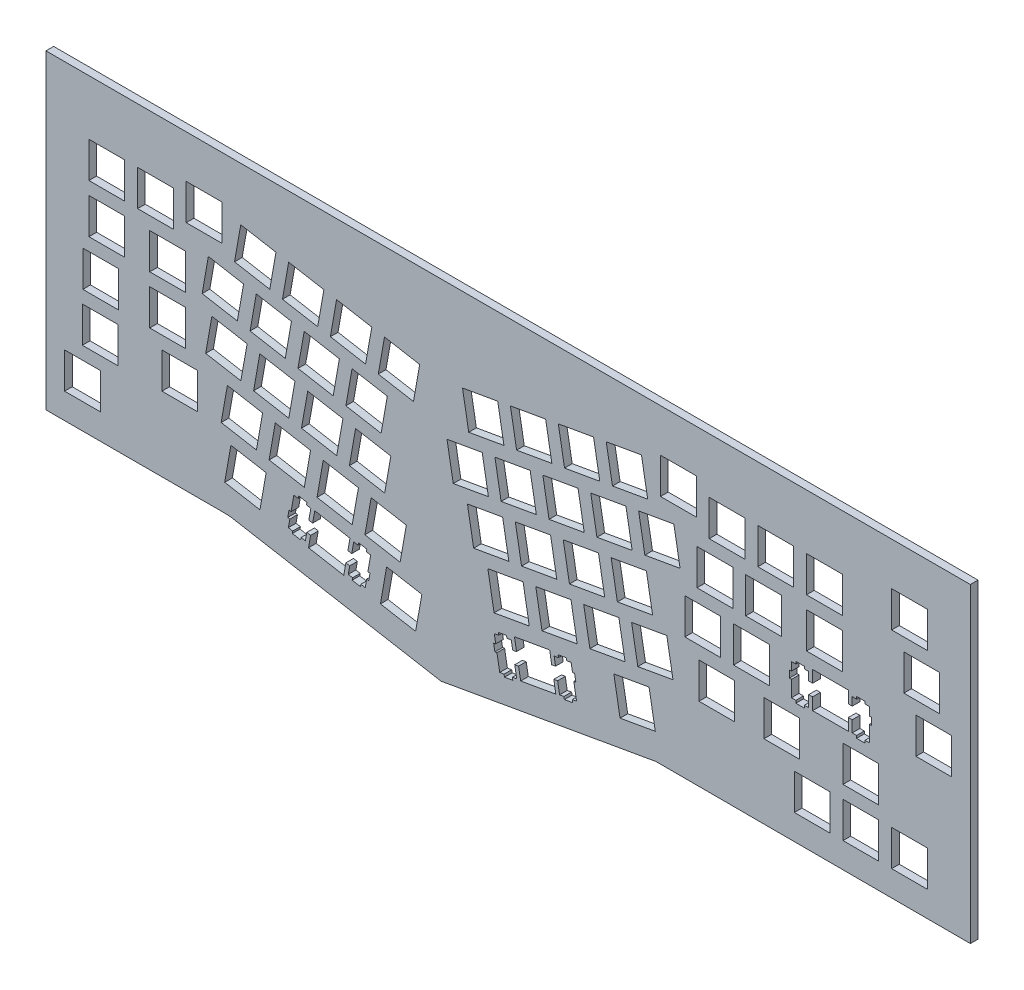
from build123d import *

# Parameters (mm, degrees)
RESSALTO_EXTRUS_O1_OUTLINE_W    = 385.763002014
RESSALTO_EXTRUS_O1_OUTLINE_H    = 172.784175795
RESSALTO_EXTRUS_O1_OUTLINE_W_2  = 13.999553143
RESSALTO_EXTRUS_O1_OUTLINE_H_2  = 14.000893144
RESSALTO_EXTRUS_O1_OUTLINE_W_3  = 13.999543143
RESSALTO_EXTRUS_O1_OUTLINE_H_3  = 14.000703143
RESSALTO_EXTRUS_O1_OUTLINE_W_4  = 13.998003143
RESSALTO_EXTRUS_O1_OUTLINE_W_5  = 14.000003143
RESSALTO_EXTRUS_O1_OUTLINE_W_6  = 14.000003144
RESSALTO_EXTRUS_O1_OUTLINE_W_7  = 13.999503143
RESSALTO_EXTRUS_O1_OUTLINE_H_4  = 13.999303143
RESSALTO_EXTRUS_O1_OUTLINE_H_5  = 13.999103143
RESSALTO_EXTRUS_O1_OUTLINE_W_8  = 13.999303144
RESSALTO_EXTRUS_O1_OUTLINE_W_9  = 13.999303143
RESSALTO_EXTRUS_O1_OUTLINE_W_10 = 13.999403143
RESSALTO_EXTRUS_O1_OUTLINE_H_6  = 13.999003143
RESSALTO_EXTRUS_O1_OUTLINE_H_7  = 14.000003143
RESSALTO_EXTRUS_O1_OUTLINE_W_11 = 14.001003144
RESSALTO_EXTRUS_O1_OUTLINE_W_12 = 13.999003143
RESSALTO_EXTRUS_O1_OUTLINE_H_8  = 14.000003144
RESSALTO_EXTRUS_O1_OUTLINE_W_13 = 13.999003144
RESSALTO_EXTRUS_O1_DEPTH        = 3
CORTE_EXTRUS_O1_DEPTH           = 3


# Read off the part's stored shape, not the designer's step: Ressalto-extrusão1
with BuildPart() as part:
    # Ressalto-extrusão1 outline → Ressalto-extrusão1 (new body)
    with BuildSketch(Plane.XY):
        with Locations((-32.928151592, -125.295959232)):
            Rectangle(RESSALTO_EXTRUS_O1_OUTLINE_W, RESSALTO_EXTRUS_O1_OUTLINE_H)
        with Locations((-216.285310061, -202.161652991)):
            Rectangle(RESSALTO_EXTRUS_O1_OUTLINE_W_2, RESSALTO_EXTRUS_O1_OUTLINE_H_2, mode=Mode.SUBTRACT)
        with Locations((-211.522803992, -143.677644859)):
            Rectangle(RESSALTO_EXTRUS_O1_OUTLINE_W_3, RESSALTO_EXTRUS_O1_OUTLINE_H_3, mode=Mode.SUBTRACT)
        Polygon((-142.042718391, -152.663796877), (-155.830021487, -150.233196332), (-153.399320941, -136.447293236), (-139.610717845, -138.877993782), align=None, mode=Mode.SUBTRACT)
        Polygon((-124.664714489, -136.385193222), (-138.451817585, -133.954192677), (-136.020817039, -120.166989581), (-122.233713943, -122.597990127), align=None, mode=Mode.SUBTRACT)
        Polygon((-128.757115408, -141.024994264), (-127.058115027, -141.324094331), (-126.888414988, -140.359294115), (-123.637714259, -140.932494243), (-123.808714297, -141.89739446), (-122.109713916, -142.197594527), (-122.88671409, -146.599195516), (-121.384713753, -146.865195575), (-120.56871357, -142.234994536), (-106.779710474, -144.666995082), (-107.595710657, -149.295796121), (-106.09571032, -149.560396181), (-105.317710145, -145.157795192), (-103.620709764, -145.457995259), (-103.449709726, -144.492095043), (-100.199708996, -145.065295171), (-100.369709034, -146.030195388), (-98.671708653, -146.330395455), (-99.760708898, -152.503996841), (-98.947708715, -152.648596874), (-99.433708824, -155.404897493), (-100.245709006, -155.262697461), (-100.807709133, -158.443398175), (-102.506709514, -158.143198108), (-102.66570955, -159.049798311), (-105.914710279, -158.476498182), (-105.756710244, -157.570897979), (-107.453710625, -157.272097912), (-106.893710499, -154.090097198), (-108.394710836, -153.825497138), (-109.210711019, -158.452898177), (-122.999714115, -156.022197631), (-122.182713932, -151.394896592), (-123.684714269, -151.130296533), (-124.245714395, -154.310597247), (-125.944414777, -154.01039718), (-126.104614812, -154.916997383), (-129.353715542, -154.343697255), (-129.193815506, -153.437097051), (-130.893215888, -153.137896984), (-130.332315762, -149.95729627), (-131.144015944, -149.814096237), (-130.658915835, -147.056795618), (-129.845815652, -147.199995651), align=None, mode=Mode.SUBTRACT)
        Polygon((-81.071704701, -163.415399291), (-94.858707797, -160.984398746), (-92.426707251, -147.19719565), (-78.639704155, -149.628196196), align=None, mode=Mode.SUBTRACT)
        Polygon((-25.135692142, -144.336495008), (-25.293692178, -143.430894804), (-22.044691448, -142.857594676), (-21.884691412, -143.763194879), (-20.185691031, -143.464094812), (-19.624690905, -146.644695526), (-18.813690723, -146.501495494), (-18.326690613, -149.258796113), (-19.139690796, -149.401996145), (-18.049690551, -155.576997531), (-19.748690933, -155.876197599), (-19.579690895, -156.842097815), (-22.828691624, -157.413997944), (-22.999691663, -156.449497727), (-24.698692044, -156.748297794), (-25.474692218, -152.346996806), (-26.976692556, -152.611596866), (-26.160692372, -157.240397905), (-39.946695468, -159.671398451), (-40.763695651, -155.042197411), (-42.264695988, -155.306797471), (-41.488695814, -159.709798459), (-43.187696195, -160.008998527), (-43.016696157, -160.974898743), (-46.267696887, -161.548198872), (-46.436696925, -160.582298655), (-48.136697307, -160.881098722), (-49.224697551, -154.707397336), (-50.036697733, -154.850697368), (-50.524697843, -152.091996749), (-49.71169766, -151.950096717), (-50.272697786, -148.768096003), (-48.572697404, -148.469295936), (-48.73269744, -147.563695732), (-45.483696711, -146.990395603), (-45.323696675, -147.895995807), (-43.624696294, -147.59689574), (-43.063696168, -150.777496454), (-41.56169583, -150.512896394), (-42.377696014, -145.884095355), (-28.591692918, -143.453094809), (-27.775692735, -148.081895849), (-26.273692398, -147.815895789), (-26.834692524, -144.635295075), align=None, mode=Mode.SUBTRACT)
        Polygon((-105.903710277, -139.693893965), (-119.690713372, -137.262893419), (-117.259712827, -123.474290324), (-103.472709731, -125.90669087), align=None, mode=Mode.SUBTRACT)
        Polygon((-87.142706064, -143.001194708), (-100.93070916, -140.570194162), (-98.499708614, -126.782991066), (-84.712705519, -129.213991612), align=None, mode=Mode.SUBTRACT)
        Polygon((-50.356697805, -141.775994433), (-52.786698351, -127.988791337), (-38.999695255, -125.557790791), (-36.569694709, -139.344993887), align=None, mode=Mode.SUBTRACT)
        with Locations((150.428347277, -202.161652991)):
            Rectangle(RESSALTO_EXTRUS_O1_OUTLINE_W_4, RESSALTO_EXTRUS_O1_OUTLINE_H_2, mode=Mode.SUBTRACT)
        Polygon((-1.019686728, -152.80739691), (-3.450687273, -139.019793814), (10.338315823, -136.589093268), (12.769316368, -150.376396364), align=None, mode=Mode.SUBTRACT)
        Polygon((-31.595693593, -138.46869369), (-34.026694139, -124.680090594), (-20.239691043, -122.249090048), (-17.808690497, -136.036293144), align=None, mode=Mode.SUBTRACT)
        Polygon((-12.83468938, -135.159992947), (-15.265689926, -121.372789852), (-1.478686831, -118.941789306), (0.952313715, -132.727992401), align=None, mode=Mode.SUBTRACT)
        with Locations((74.227330168, -143.677644859)):
            Rectangle(RESSALTO_EXTRUS_O1_OUTLINE_W_5, RESSALTO_EXTRUS_O1_OUTLINE_H_3, mode=Mode.SUBTRACT)
        with Locations((93.277334445, -143.677644859)):
            Rectangle(RESSALTO_EXTRUS_O1_OUTLINE_W_5, RESSALTO_EXTRUS_O1_OUTLINE_H_3, mode=Mode.SUBTRACT)
        with Locations((112.327338722, -143.677644859)):
            Rectangle(RESSALTO_EXTRUS_O1_OUTLINE_W_6, RESSALTO_EXTRUS_O1_OUTLINE_H_3, mode=Mode.SUBTRACT)
        with Locations((-204.570682431, -124.628340583)):
            Rectangle(RESSALTO_EXTRUS_O1_OUTLINE_W_7, RESSALTO_EXTRUS_O1_OUTLINE_H_4, mode=Mode.SUBTRACT)
        with Locations((-204.379082388, -105.578436306)):
            Rectangle(RESSALTO_EXTRUS_O1_OUTLINE_W_7, RESSALTO_EXTRUS_O1_OUTLINE_H_5, mode=Mode.SUBTRACT)
        with Locations((-178.185376506, -105.578436306)):
            Rectangle(RESSALTO_EXTRUS_O1_OUTLINE_W_8, RESSALTO_EXTRUS_O1_OUTLINE_H_5, mode=Mode.SUBTRACT)
        with Locations((-173.422875437, -124.628340583)):
            Rectangle(RESSALTO_EXTRUS_O1_OUTLINE_W_9, RESSALTO_EXTRUS_O1_OUTLINE_H_4, mode=Mode.SUBTRACT)
        Polygon((-143.424918701, -133.07789248), (-157.212221797, -130.646891934), (-154.781521251, -116.859688838), (-140.994318156, -119.290689384), align=None, mode=Mode.SUBTRACT)
        Polygon((-149.496620065, -112.662287896), (-163.28382316, -110.23088735), (-160.853222614, -96.443884254), (-147.065919519, -98.8748848), align=None, mode=Mode.SUBTRACT)
        Polygon((-130.735815852, -115.970988639), (-144.524518948, -113.539988093), (-142.093918403, -99.752884997), (-128.305215307, -102.183885543), align=None, mode=Mode.SUBTRACT)
        with Locations((-201.997831853, -86.528382029)):
            Rectangle(RESSALTO_EXTRUS_O1_OUTLINE_W_10, RESSALTO_EXTRUS_O1_OUTLINE_H_6, mode=Mode.SUBTRACT)
        with Locations((-178.185376506, -86.528382029)):
            Rectangle(RESSALTO_EXTRUS_O1_OUTLINE_W_8, RESSALTO_EXTRUS_O1_OUTLINE_H_6, mode=Mode.SUBTRACT)
        Polygon((-150.878720375, -93.075883498), (-164.666023471, -90.643882952), (-162.235422925, -76.856879857), (-148.447819829, -79.287880402), align=None, mode=Mode.SUBTRACT)
        Polygon((-132.118016163, -96.383884241), (-145.906719259, -93.952883695), (-143.474618713, -80.163880599), (-129.687415617, -82.595881145), align=None, mode=Mode.SUBTRACT)
        Polygon((-111.97671164, -119.278289381), (-125.762714736, -116.847288836), (-123.33171419, -103.05988574), (-109.544711094, -105.490886286), align=None, mode=Mode.SUBTRACT)
        Polygon((-93.214707428, -122.586690124), (-107.001710523, -120.155989578), (-104.570709978, -106.368886483), (-90.783706882, -108.799887029), align=None, mode=Mode.SUBTRACT)
        Polygon((-58.354699601, -123.842190406), (-60.785700147, -110.05488731), (-46.997697051, -107.623886765), (-44.567696505, -121.41118986), align=None, mode=Mode.SUBTRACT)
        Polygon((-39.593695388, -120.534889664), (-42.024695934, -106.747886568), (-28.237692839, -104.316886022), (-25.806692293, -118.103889118), align=None, mode=Mode.SUBTRACT)
        Polygon((-94.596707738, -102.998885726), (-108.385710834, -100.568885181), (-105.953710288, -86.779882085), (-92.165707192, -89.211882631), align=None, mode=Mode.SUBTRACT)
        Polygon((-113.35771195, -99.691884984), (-127.144915046, -97.259884438), (-124.7137145, -83.472881342), (-110.926711405, -85.903881888), align=None, mode=Mode.SUBTRACT)
        Polygon((-66.352701397, -105.90888638), (-68.783701942, -92.120883284), (-54.996698847, -89.689882738), (-52.565698301, -103.477885834), align=None, mode=Mode.SUBTRACT)
        Polygon((-47.591697184, -102.600885637), (-50.02269773, -88.813882541), (-36.235694634, -86.382881995), (-33.804694089, -100.168885091), align=None, mode=Mode.SUBTRACT)
        with Locations((-201.997831853, -67.478377751)):
            Rectangle(RESSALTO_EXTRUS_O1_OUTLINE_W_10, RESSALTO_EXTRUS_O1_OUTLINE_H_6, mode=Mode.SUBTRACT)
        with Locations((-182.947877576, -67.478377751)):
            Rectangle(RESSALTO_EXTRUS_O1_OUTLINE_W_9, RESSALTO_EXTRUS_O1_OUTLINE_H_6, mode=Mode.SUBTRACT)
        with Locations((-163.897873298, -62.715876682)):
            Rectangle(RESSALTO_EXTRUS_O1_OUTLINE_W_8, RESSALTO_EXTRUS_O1_OUTLINE_H_7, mode=Mode.SUBTRACT)
        Polygon((-138.191117526, -75.968879657), (-151.978420622, -73.536879111), (-149.547720076, -59.750876016), (-135.76051698, -62.181876562), align=None, mode=Mode.SUBTRACT)
        Polygon((-100.671709102, -82.584881143), (-114.457712197, -80.152880597), (-112.026711652, -66.366877501), (-98.237708556, -68.797878047), align=None, mode=Mode.SUBTRACT)
        Polygon((-81.90970489, -85.892881885), (-95.696707985, -83.46188134), (-93.265707439, -69.673878244), (-79.478704344, -72.10487879), align=None, mode=Mode.SUBTRACT)
        Polygon((-119.430713314, -79.2768804), (-133.21801641, -76.845879854), (-130.785615864, -63.057876758), (-116.999712768, -65.488877304), align=None, mode=Mode.SUBTRACT)
        Polygon((-60.279700033, -85.493881796), (-62.710700579, -71.7068787), (-48.924697484, -69.275878154), (-46.493696938, -83.06288125), align=None, mode=Mode.SUBTRACT)
        Polygon((-41.520695821, -82.186881053), (-43.951696367, -68.397877957), (-30.162693271, -65.966877412), (-27.731692725, -79.755880508), align=None, mode=Mode.SUBTRACT)
        Polygon((5.925314832, -131.852692205), (3.493314286, -118.064089109), (17.282317382, -115.633388563), (19.712317927, -129.420691659), align=None, mode=Mode.SUBTRACT)
        Polygon((-20.833691176, -117.226188921), (-23.264691722, -103.438885825), (-9.476688626, -101.007885279), (-7.045688081, -114.795588375), align=None, mode=Mode.SUBTRACT)
        Polygon((-2.072686964, -113.918888178), (-4.50368751, -100.131885083), (9.283315586, -97.700884537), (11.714316132, -111.487887632), align=None, mode=Mode.SUBTRACT)
        with Locations((36.888821784, -124.628340583)):
            Rectangle(RESSALTO_EXTRUS_O1_OUTLINE_W_11, RESSALTO_EXTRUS_O1_OUTLINE_H_4, mode=Mode.SUBTRACT)
        with Locations((62.320827495, -124.628340583)):
            Rectangle(RESSALTO_EXTRUS_O1_OUTLINE_W_12, RESSALTO_EXTRUS_O1_OUTLINE_H_4, mode=Mode.SUBTRACT)
        with Locations((31.364820544, -105.578436306)):
            Rectangle(RESSALTO_EXTRUS_O1_OUTLINE_W_12, RESSALTO_EXTRUS_O1_OUTLINE_H_5, mode=Mode.SUBTRACT)
        with Locations((50.414824821, -105.578436306)):
            Rectangle(RESSALTO_EXTRUS_O1_OUTLINE_W_12, RESSALTO_EXTRUS_O1_OUTLINE_H_5, mode=Mode.SUBTRACT)
        Polygon((-28.831692972, -99.290884894), (-31.262693518, -85.504881798), (-17.474690422, -83.074881253), (-15.043689876, -96.861884348), align=None, mode=Mode.SUBTRACT)
        Polygon((-10.07068876, -95.983884151), (-12.501689306, -82.197881056), (1.28431379, -79.76688051), (3.716314336, -93.552883605), align=None, mode=Mode.SUBTRACT)
        Polygon((8.689315452, -92.676883409), (6.259314907, -78.888880313), (20.046318002, -76.458879767), (22.477318548, -90.245882863), align=None, mode=Mode.SUBTRACT)
        with Locations((36.127321613, -86.528382029)):
            Rectangle(RESSALTO_EXTRUS_O1_OUTLINE_W_6, RESSALTO_EXTRUS_O1_OUTLINE_H_6, mode=Mode.SUBTRACT)
        with Locations((55.17732589, -86.528382029)):
            Rectangle(RESSALTO_EXTRUS_O1_OUTLINE_W_6, RESSALTO_EXTRUS_O1_OUTLINE_H_6, mode=Mode.SUBTRACT)
        with Locations((93.277334445, -124.628340583)):
            Rectangle(RESSALTO_EXTRUS_O1_OUTLINE_W_5, RESSALTO_EXTRUS_O1_OUTLINE_H_4, mode=Mode.SUBTRACT)
        Polygon((74.3713302, -103.278885789), (74.3713302, -98.578884734), (88.370333343, -98.578884734), (88.370333343, -103.278885789), (89.896333686, -103.278885789), (89.896333686, -100.048885064), (91.621334073, -100.048885064), (91.621334073, -99.126884857), (94.920334814, -99.126884857), (94.920334814, -100.048885064), (96.645335201, -100.048885064), (96.645335201, -103.278885789), (97.471335386, -103.278885789), (97.471335386, -106.077886418), (96.645335201, -106.077886418), (96.645335201, -112.347987825), (94.920334814, -112.347987825), (94.920334814, -113.329088046), (91.621334073, -113.329088046), (91.621334073, -112.347987825), (89.896333686, -112.347987825), (89.896333686, -107.878886822), (88.370333343, -107.878886822), (88.370333343, -112.577987877), (74.3713302, -112.577987877), (74.3713302, -107.878886822), (72.846329857, -107.878886822), (72.846329857, -112.347987825), (71.12032947, -112.347987825), (71.12032947, -113.329088046), (67.821328729, -113.329088046), (67.821328729, -112.347987825), (66.096328342, -112.347987825), (66.096328342, -106.077886418), (65.270328156, -106.077886418), (65.270328156, -103.278885789), (66.096328342, -103.278885789), (66.096328342, -100.048885064), (67.821328729, -100.048885064), (67.821328729, -99.126884857), (71.12032947, -99.126884857), (71.12032947, -100.048885064), (72.846329857, -100.048885064), (72.846329857, -103.278885789), align=None, mode=Mode.SUBTRACT)
        with Locations((78.989831237, -86.528382029)):
            Rectangle(RESSALTO_EXTRUS_O1_OUTLINE_W_12, RESSALTO_EXTRUS_O1_OUTLINE_H_6, mode=Mode.SUBTRACT)
        with Locations((121.852340861, -100.815885236)):
            Rectangle(RESSALTO_EXTRUS_O1_OUTLINE_W_5, RESSALTO_EXTRUS_O1_OUTLINE_H_8, mode=Mode.SUBTRACT)
        Polygon((-22.759691609, -78.87788031), (-25.190692155, -65.090877215), (-11.403689059, -62.659876669), (-8.972688513, -76.446879765), align=None, mode=Mode.SUBTRACT)
        Polygon((-3.997687396, -75.570879568), (-6.429687942, -61.781876472), (7.357315153, -59.350875926), (9.789315699, -73.139879022), align=None, mode=Mode.SUBTRACT)
        with Locations((21.839818405, -62.715876682)):
            Rectangle(RESSALTO_EXTRUS_O1_OUTLINE_W_13, RESSALTO_EXTRUS_O1_OUTLINE_H_7, mode=Mode.SUBTRACT)
        with Locations((40.889822682, -67.478377751)):
            Rectangle(RESSALTO_EXTRUS_O1_OUTLINE_W_12, RESSALTO_EXTRUS_O1_OUTLINE_H_6, mode=Mode.SUBTRACT)
        with Locations((59.93982696, -67.478377751)):
            Rectangle(RESSALTO_EXTRUS_O1_OUTLINE_W_12, RESSALTO_EXTRUS_O1_OUTLINE_H_6, mode=Mode.SUBTRACT)
        with Locations((78.989831237, -67.478377751)):
            Rectangle(RESSALTO_EXTRUS_O1_OUTLINE_W_12, RESSALTO_EXTRUS_O1_OUTLINE_H_6, mode=Mode.SUBTRACT)
        with Locations((117.089839791, -81.765880959)):
            Rectangle(RESSALTO_EXTRUS_O1_OUTLINE_W_12, RESSALTO_EXTRUS_O1_OUTLINE_H_8, mode=Mode.SUBTRACT)
        with Locations((112.327338722, -62.715876682)):
            Rectangle(RESSALTO_EXTRUS_O1_OUTLINE_W_6, RESSALTO_EXTRUS_O1_OUTLINE_H_7, mode=Mode.SUBTRACT)
    extrude(amount=RESSALTO_EXTRUS_O1_DEPTH)

    # Esboço2 → Corte-extrusão1 (cut)
    with BuildSketch(Plane.XY.offset(3)):
        Polygon((-225.809652599, -160.677996431), (-225.809652599, -211.68804713), (159.953349415, -211.68804713), (159.953349415, -38.903871335), (136.142342432, -38.903871335), (136.142342432, -160.677996431), (13.03442747, -160.483082346), (-71.116906176, -175.322186661), (-153.587996554, -160.784331894), (-156.132242037, -160.677996431), align=None)
    extrude(amount=-CORTE_EXTRUS_O1_DEPTH, mode=Mode.SUBTRACT)


solid = part.part
